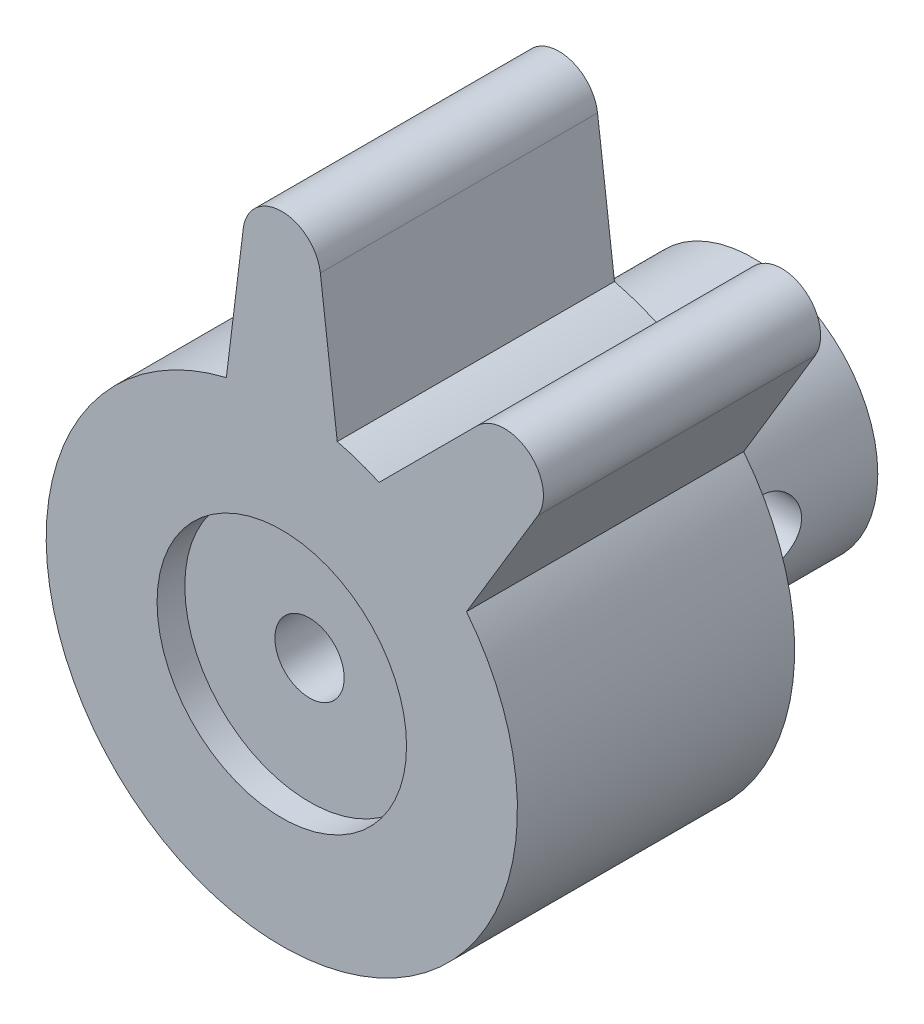
from build123d import *

# Parameters (mm, degrees)
SKETCH1_R               = 1.25
BOSS_EXTRUDE1_DEPTH     = 10
SKETCH5_R               = 4.5
SKETCH5_R_2             = 3
BOSS_EXTRUDE3_DEPTH     = 7
CUT_EXTRUDE1_DEPTH      = 20.949878445
CUT_EXTRUDE1_DEPTH_BACK = 20.949878445
SKETCH6_R               = 1.25
SKETCH8_R               = 4.5
CUT_EXTRUDE2_DEPTH      = 1


with BuildPart() as part:
    # Sketch1 → Boss-Extrude1 (new body)
    with BuildSketch(Plane.XY):
        with BuildLine():
            Line((-1.390653283, 13.224086579), (-2, 8.261355821))
            ThreePointArc((-2, 8.261355821), (-2.767329313, -8.036907893), (6.66222002, 5.278714276))
            Line((6.66222002, 5.278714276), (9.237410395, 9.564550779))
            ThreePointArc((9.237410395, 9.564550779), (8.899037344, 11.390248383), (7.045710912, 11.276894083))
            Line((7.045710912, 11.276894083), (3.510177006, 7.741360177))
            ThreePointArc((3.510177006, 7.741360177), (2.767329313, 8.036907893), (2, 8.261355821))
            Line((2, 8.261355821), (1.390653283, 13.224086579))
            ThreePointArc((1.390653283, 13.224086579), (0, 14.454432673), (-1.390653283, 13.224086579))
        make_face()
        Circle(SKETCH1_R, mode=Mode.SUBTRACT)
    extrude(amount=BOSS_EXTRUDE1_DEPTH)

    # Sketch5 → Boss-Extrude3 (add)
    with BuildSketch(Plane(origin=(0, 0, 0), x_dir=(-1, 0, 0), z_dir=(0, 0, -1))):
        Circle(SKETCH5_R)
        Circle(SKETCH5_R_2, mode=Mode.SUBTRACT)
    extrude(amount=BOSS_EXTRUDE3_DEPTH)

    # Sketch6 → Cut-Extrude1 (cut, two sides: drawn at the far end of the back side and taken through both)
    with BuildSketch(Plane(origin=(0, 0, 0), x_dir=(0, 0, -1), z_dir=(1, 0, 0)).offset(-CUT_EXTRUDE1_DEPTH_BACK)):
        with Locations((3, 0)):
            Circle(SKETCH6_R)
    extrude(amount=CUT_EXTRUDE1_DEPTH + CUT_EXTRUDE1_DEPTH_BACK, mode=Mode.SUBTRACT)

    # Sketch8 → Cut-Extrude2 (cut)
    with BuildSketch(Plane.XY.offset(10)):
        Circle(SKETCH8_R)
    extrude(amount=-CUT_EXTRUDE2_DEPTH, mode=Mode.SUBTRACT)


solid = part.part
